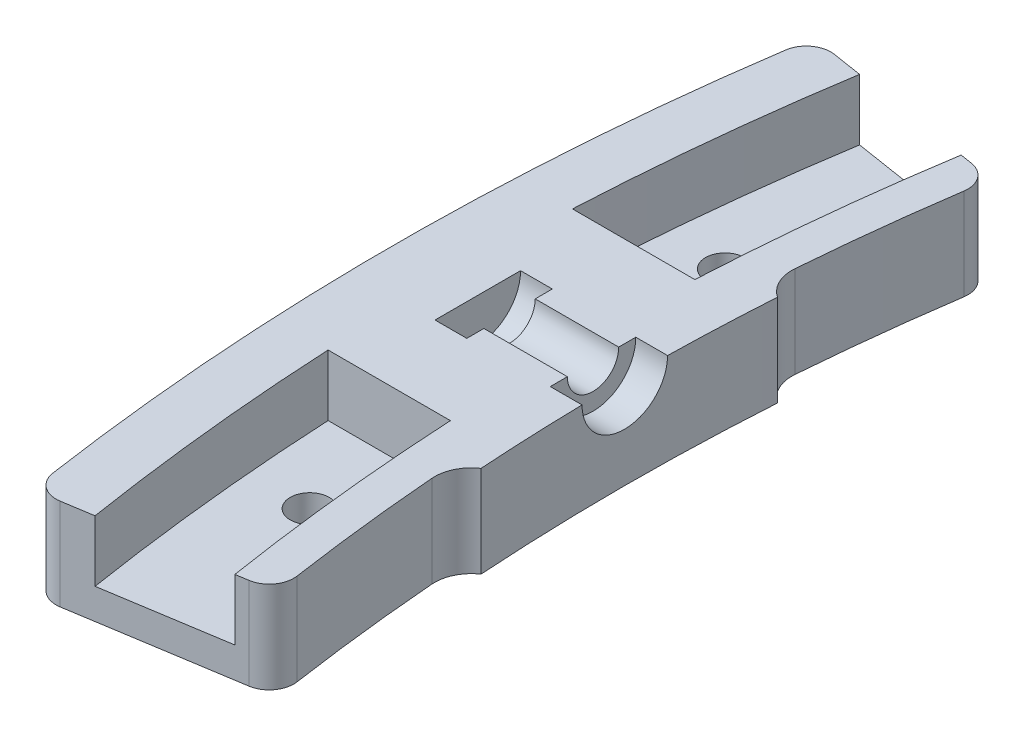
from build123d import *

# Parameters (mm, degrees)
BOSS_EXTRUDE1_DEPTH        = 10
CUT_EXTRUDE1_DEPTH         = 5
F_3_2_3_2_DIAMETER_HOLE1_D = 3.2
BOSS_EXTRUDE2_DEPTH        = 10
FILLET1_R                  = 3
FILLET2_R                  = 2
SKETCH21_R                 = 2.1
CUT_EXTRUDE2_DEPTH         = 36.522103107
SKETCH22_R                 = 3.5
CUT_EXTRUDE3_DEPTH         = 2.6
CUT_EXTRUDE6_DEPTH         = 2.5
SKETCH27_W                 = 2.6
SKETCH27_H                 = 3.5


with BuildPart() as part:
    # Sketch1 → Boss-Extrude1 (new body)
    with BuildSketch(Plane(origin=(0, 0, 0), x_dir=(1, 0, 0), z_dir=(0, 1, 0))):
        with BuildLine():
            ThreePointArc((-187.660784713, 29.722548358), (-190, 0), (-187.660784713, -29.722548358))
            Line((-187.660784713, -29.722548358), (-197.537668119, -31.286893008))
            ThreePointArc((-197.537668119, -31.286893008), (-200, 0), (-197.537668119, 31.286893008))
            Line((-197.537668119, 31.286893008), (-187.660784713, 29.722548358))
        make_face()
        with BuildLine():
            ThreePointArc((-197.537668119, -31.286893008), (-200, 0), (-197.537668119, 31.286893008))
            Line((-197.537668119, 31.286893008), (-201.982265652, 31.990848101))
            ThreePointArc((-201.982265652, 31.990848101), (-204.5, 0), (-201.982265652, -31.990848101))
            Line((-201.982265652, -31.990848101), (-197.537668119, -31.286893008))
        make_face()
        with BuildLine():
            Line((-184.697719691, 29.253244963), (-187.660784713, 29.722548358))
            ThreePointArc((-187.660784713, 29.722548358), (-190, 0), (-187.660784713, -29.722548358))
            Line((-187.660784713, -29.722548358), (-184.697719691, -29.253244963))
            ThreePointArc((-184.697719691, -29.253244963), (-187, 0), (-184.697719691, 29.253244963))
        make_face()
    extrude(amount=BOSS_EXTRUDE1_DEPTH)

    # Sketch15 → Cut-Extrude1 (cut)
    with BuildSketch(Plane(origin=(0, 10, 0), x_dir=(1, 0, 0), z_dir=(0, 1, 0))):
        with BuildLine():
            Line((-199.749843554, 10), (-189.73665961, 10))
            ThreePointArc((-189.73665961, 10), (-188.956218405, 19.88837666), (-187.660784713, 29.722548358))
            Line((-187.660784713, 29.722548358), (-197.537668119, 31.286893008))
            ThreePointArc((-197.537668119, 31.286893008), (-198.928692466, 20.673057674), (-199.749843554, 10))
        make_face()
        with BuildLine():
            ThreePointArc((-187.660784713, -29.722548358), (-188.956218405, -19.88837666), (-189.73665961, -10))
            Line((-189.73665961, -10), (-199.749843554, -10))
            ThreePointArc((-199.749843554, -10), (-198.928692466, -20.673057674), (-197.537668119, -31.286893008))
            Line((-197.537668119, -31.286893008), (-187.660784713, -29.722548358))
        make_face()
    extrude(amount=-CUT_EXTRUDE1_DEPTH, mode=Mode.SUBTRACT)

    # Ø3.2 (3.2) Diameter Hole1 (through all)
    with Locations(Plane(origin=(0, 0, 0), x_dir=(-1, 0, 0), z_dir=(0, -1, 0))):
        with Locations((194.257966128, -16.995369836), (194.257966128, 16.995369836)):
            Hole(F_3_2_3_2_DIAMETER_HOLE1_D / 2)

    # Sketch19 → Boss-Extrude2 (add)
    with BuildSketch(Plane(origin=(0, 0, 0), x_dir=(1, 0, 0), z_dir=(0, 1, 0))):
        with BuildLine():
            Line((-185.102830261, -12.132280472), (-186.599618646, -12.230385166))
            ThreePointArc((-186.599618646, -12.230385166), (-187, 0), (-186.599618646, 12.230385166))
            Line((-186.599618646, 12.230385166), (-185.102830261, 12.132280472))
            ThreePointArc((-185.102830261, 12.132280472), (-185.5, 0), (-185.102830261, -12.132280472))
        make_face()
    extrude(amount=BOSS_EXTRUDE2_DEPTH)

    # Fillet1
    # the kernel refuses this fillet: 3 mm, written as the material it adds along each edge
    with BuildSketch(Plane(origin=(-186.599618646, 0, -12.230385166), x_dir=(0.07241784502459461, 0, -0.9973743809232287), z_dir=(0, 1, 0))) as fillet1_piece_1:
        with BuildLine():
            CenterArc((2.608644701, -2.999925838), FILLET1_R, 89.597127862, 60.403689883)
            Line((0.010547081, -1.499962919), (-0.041414871, -1.469963661))
            ThreePointArc((-0.041414871, -1.469963661), (-0.054724976, -0.750403343), (-0.059998517, -0.000421883))
            Line((-0.059998517, -0.000421883), (-0.000421883, 0.059998517))
            ThreePointArc((-0.000421883, 0.059998517), (1.314869431, 0.064622735), (2.630160746, 0.059998517))
            Line((2.630160746, 0.059998517), (2.629738863, 0))
        make_face()
    extrude(amount=10)
    with BuildSketch(Plane(origin=(-186.599618646, 0, 12.230385166), x_dir=(0.0724178450245846, 0, 0.9973743809232295), z_dir=(0, 1, 0))) as fillet1_piece_2:
        with BuildLine():
            CenterArc((2.608644701, 2.999925838), FILLET1_R, 209.999182255, 60.403689883)
            Line((0.010547081, 1.499962919), (-0.041414871, 1.469963661))
            ThreePointArc((-0.041414871, 1.469963661), (-0.054724976, 0.750403343), (-0.059998517, 0.000421883))
            Line((-0.059998517, 0.000421883), (-0.000421883, -0.059998517))
            ThreePointArc((-0.000421883, -0.059998517), (1.314869431, -0.064622735), (2.630160746, -0.059998517))
            Line((2.630160746, -0.059998517), (2.629738863, 0))
        make_face()
    extrude(amount=10)

    # Fillet2
    fillet2_edges = [part.edges().sort_by_distance(p)[0] for p in [
        (-201.982265652, 5, 31.990848101),
        (-201.982265652, 5, -31.990848101),
        (-184.697719691, 5, -29.253244963),
        (-184.697719691, 5, 29.253244963),
    ]]
    fillet(fillet2_edges, radius=FILLET2_R)

    # Sketch21 → Cut-Extrude2 (cut, through all)
    with BuildSketch(Plane(origin=(-197.5, 0, 0), x_dir=(0, 0, -1), z_dir=(1, 0, 0))):
        with Locations((0, 10)):
            Circle(SKETCH21_R)
    extrude(amount=CUT_EXTRUDE2_DEPTH, mode=Mode.SUBTRACT)

    # Sketch22 → Cut-Extrude3 (cut)
    with BuildSketch(Plane(origin=(-197.5, 0, 0), x_dir=(0, 0, -1), z_dir=(1, 0, 0))):
        with Locations((0, 10)):
            Circle(SKETCH22_R)
    extrude(amount=CUT_EXTRUDE3_DEPTH, mode=Mode.SUBTRACT)

    # Sketch26 → Cut-Extrude6 (cut)
    with BuildSketch(Plane.XZ):
        with BuildLine():
            Line((-199.997133786, -31.676434101), (-186.662644351, -29.564458455))
            ThreePointArc((-186.662644351, -29.564458455), (-185.363721979, -28.773196969), (-184.996936421, -27.297133819))
            ThreePointArc((-184.996936421, -27.297133819), (-185.807261228, -21.087002508), (-186.409178624, -14.853219336))
            ThreePointArc((-186.409178624, -14.853219336), (-186.123110766, -13.316498702), (-185.102830261, -12.132280472))
            ThreePointArc((-185.102830261, -12.132280472), (-185.5, 0), (-185.102830261, 12.132280472))
            ThreePointArc((-185.102830261, 12.132280472), (-186.123110766, 13.316498702), (-186.409178624, 14.853219336))
            ThreePointArc((-186.409178624, 14.853219336), (-185.807261228, 21.087002508), (-184.996936421, 27.297133819))
            ThreePointArc((-184.996936421, 27.297133819), (-185.363721979, 28.773196969), (-186.662644351, 29.564458455))
            Line((-186.662644351, 29.564458455), (-199.997133786, 31.676434101))
            ThreePointArc((-199.997133786, 31.676434101), (-201.493549275, 31.313266322), (-202.288373113, 29.994401197))
            ThreePointArc((-202.288373113, 29.994401197), (-204.5, 0), (-202.288373113, -29.994401197))
            ThreePointArc((-202.288373113, -29.994401197), (-201.493549275, -31.313266322), (-199.997133786, -31.676434101))
        make_face()
    extrude(amount=-CUT_EXTRUDE6_DEPTH, mode=Mode.SUBTRACT)

    # Sketch27 → Cut-Revolve3 (revolve, cut)
    with BuildSketch(Plane(origin=(0, 10, 0), x_dir=(1, 0, 0), z_dir=(0, 1, 0))):
        with Locations((-186.766978193, 1.75)):
            Rectangle(SKETCH27_W, SKETCH27_H)
    revolve(axis=Axis((-197.5, 10, 0), (1, 0, 0)), mode=Mode.SUBTRACT)


solid = part.part
